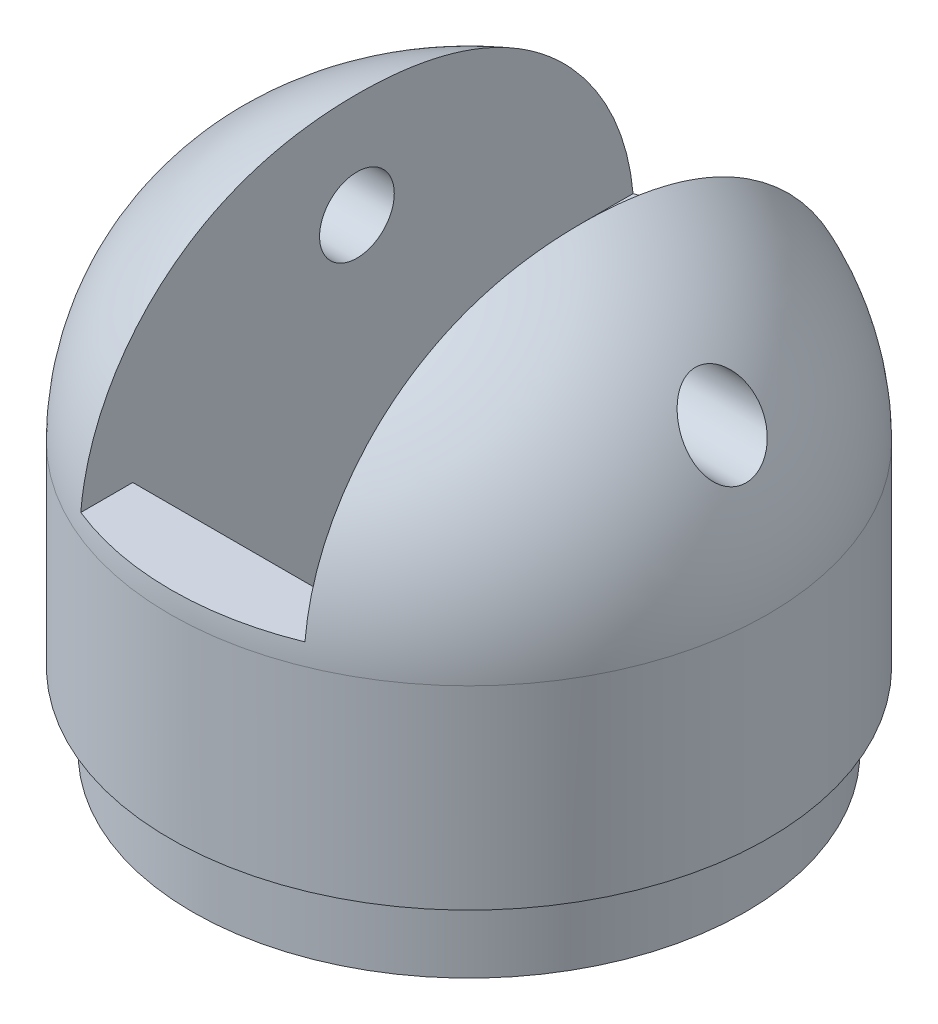
from build123d import *

# Parameters (mm, degrees)
SKETCH2_R               = 20
SKETCH2_W               = 15
SKETCH2_H               = 30
BOSS_EXTRUDE1_DEPTH     = 30
FILLET1_R               = 17
CUT_EXTRUDE1_DEPTH      = 30
CUT_EXTRUDE1_DEPTH_BACK = 30
SKETCH3_W               = 15
SKETCH3_H               = 15
BOSS_EXTRUDE3_START     = 5
SKETCH4_R               = 20
BOSS_EXTRUDE3_DEPTH     = 5
SKETCH5_R               = 20
SKETCH5_R_2             = 18.5
CUT_EXTRUDE2_DEPTH      = 5
CUT_EXTRUDE3_DEPTH      = 20
CUT_EXTRUDE3_DEPTH_BACK = 40
SKETCH6_R               = 2.5


with BuildPart() as part:
    # Sketch2 → Boss-Extrude1 (new body)
    with BuildSketch(Plane(origin=(0, 0, 0), x_dir=(1, 0, 0), z_dir=(0, 1, 0))):
        with Locations(Location((0, 0, 0), (0, 0, 270))):
            Circle(SKETCH2_R)
        Rectangle(SKETCH2_W, SKETCH2_H, mode=Mode.SUBTRACT)
    extrude(amount=BOSS_EXTRUDE1_DEPTH)

    # Fillet1
    # the kernel refuses this fillet: 17 mm, written as the material it takes off along each edge
    with BuildSketch(Plane(origin=(0, 30, 0), x_dir=(0, 0, 1), z_dir=(-1, 0, 0))) as fillet1_piece_1:
        with BuildLine():
            CenterArc((20 - FILLET1_R, -FILLET1_R), FILLET1_R, 0, 90)
            Line((20 - FILLET1_R, 0), (20, 0))
            Line((20, 0), (20, -FILLET1_R))
        make_face()
    revolve(axis=Axis((0, 30, 0), (0, 1, 0)), mode=Mode.SUBTRACT)

    # Sketch3 → Cut-Extrude1 (cut, two sides: drawn at the far end of the back side and taken through both)
    with BuildSketch(Plane.XY.offset(-CUT_EXTRUDE1_DEPTH_BACK)):
        with Locations((0, 21.893596311)):
            Rectangle(SKETCH3_W, SKETCH3_H)
    extrude(amount=CUT_EXTRUDE1_DEPTH + CUT_EXTRUDE1_DEPTH_BACK, mode=Mode.SUBTRACT)

    # Sketch4 → Boss-Extrude3 (add)
    with BuildSketch(Plane.XZ.offset(BOSS_EXTRUDE3_START)):
        with Locations(Location((0, 0, 0), (0, 0, 270))):
            Circle(SKETCH4_R)
    extrude(amount=-BOSS_EXTRUDE3_DEPTH)

    # Sketch5 → Cut-Extrude2 (cut)
    with BuildSketch(Plane.XZ.offset(5)):
        with Locations(Location((0, 0, 0), (0, 0, 270))):
            Circle(SKETCH5_R)
        with Locations(Location((0, 0, 0), (0, 0, 270))):
            Circle(SKETCH5_R_2, mode=Mode.SUBTRACT)
    extrude(amount=-CUT_EXTRUDE2_DEPTH, mode=Mode.SUBTRACT)

    # Sketch6 → Cut-Extrude3 (cut, two sides: drawn at the far end of the back side and taken through both)
    with BuildSketch(Plane(origin=(0, 0, 0), x_dir=(0, 0, -1), z_dir=(1, 0, 0)).offset(-CUT_EXTRUDE3_DEPTH_BACK)):
        with Locations(Location((0, 22.393596311, 0), (0, 0, 310.060861392))):
            Circle(SKETCH6_R)
    extrude(amount=CUT_EXTRUDE3_DEPTH + CUT_EXTRUDE3_DEPTH_BACK, mode=Mode.SUBTRACT)


solid = part.part
